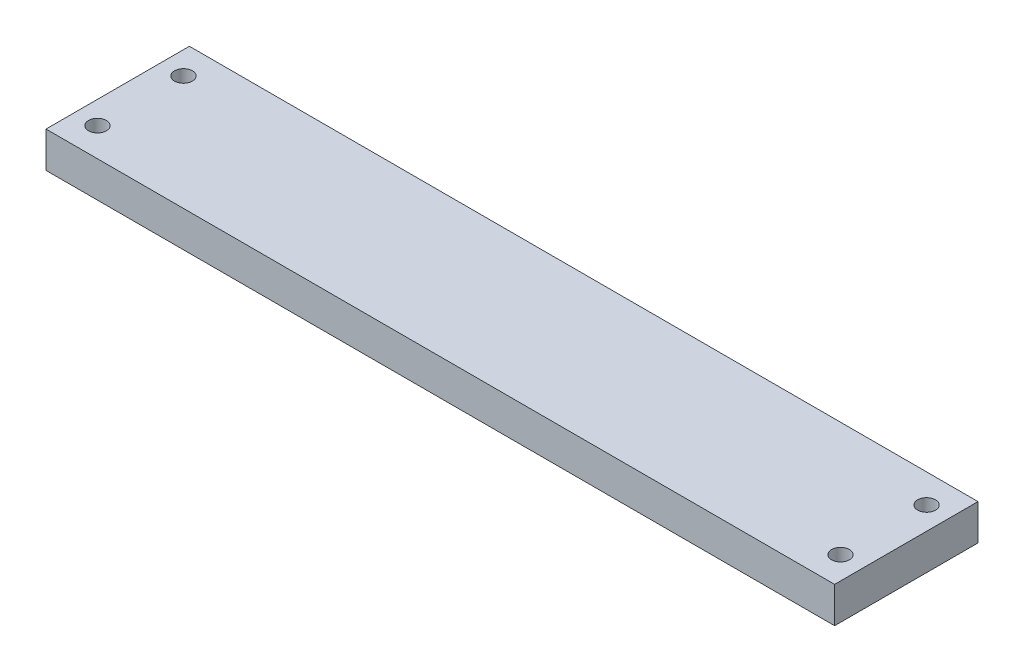
from build123d import *

# Parameters (mm, degrees)
SKETCH1_W                   = 110
SKETCH1_H                   = 20
BOSS_EXTRUDE1_DEPTH         = 2.5
TAP_DRILL_FOR_M3X0_5_TAP1_D = 2.5


with BuildPart() as part:
    # Sketch1 → Boss-Extrude1 (new, symmetric)
    with BuildSketch(Plane(origin=(0, 0, 0), x_dir=(1, 0, 0), z_dir=(0, 1, 0))):
        Rectangle(SKETCH1_W, SKETCH1_H)
    extrude(amount=BOSS_EXTRUDE1_DEPTH, both=True)

    # Tap Drill for M3x0.5 Tap1 (through all)
    with Locations(Plane(origin=(0, 2.5, 0), x_dir=(1, 0, 0), z_dir=(0, 1, 0))):
        with Locations((51.825, 6), (-51.825, -6), (51.825, -6), (-51.825, 6)):
            Hole(TAP_DRILL_FOR_M3X0_5_TAP1_D / 2)


solid = part.part
